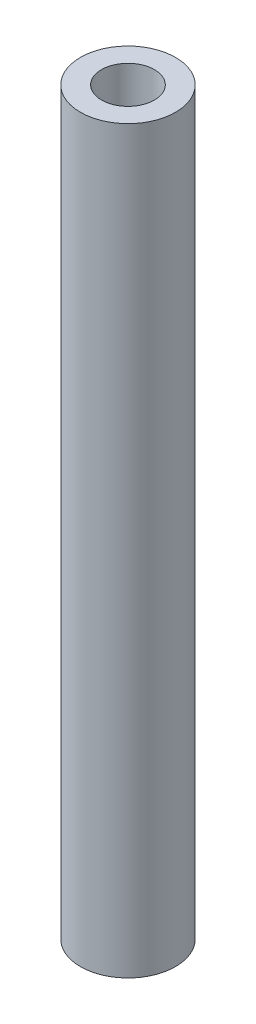
from build123d import *

# Parameters (mm, degrees)
SKETCH1_R           = 2.25
SKETCH1_R_2         = 1.25
BOSS_EXTRUDE1_DEPTH = 35


with BuildPart() as part:
    # Sketch1 → Boss-Extrude1 (new body)
    with BuildSketch(Plane(origin=(0, 0, 0), x_dir=(1, 0, 0), z_dir=(0, 1, 0))):
        Circle(SKETCH1_R)
        Circle(SKETCH1_R_2, mode=Mode.SUBTRACT)
    extrude(amount=BOSS_EXTRUDE1_DEPTH)


solid = part.part
